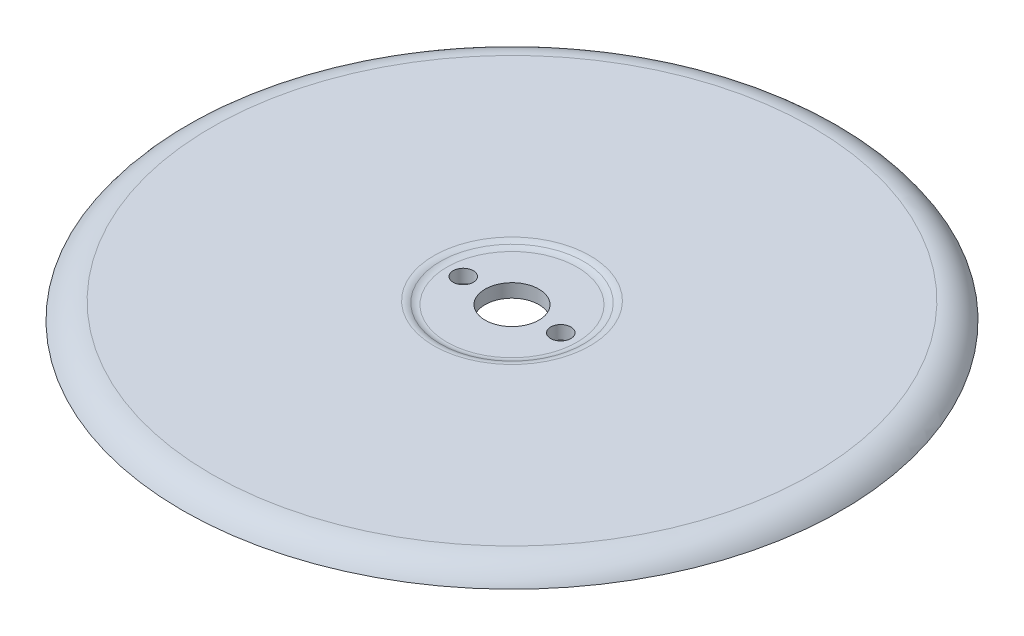
from build123d import *

# Parameters (mm, degrees)
CROQUIS1_R              = 49
CROQUIS1_R_2            = 4
CROQUIS1_R_3            = 1.5
SALIENTE_EXTRUIR1_DEPTH = 2.5
CROQUIS2_R              = 11
CORTAR_EXTRUIR1_DEPTH   = 0.5
REDONDEO1_R             = 2
REDONDEO2_R             = 2
REDONDEO3_R             = 5


with BuildPart() as part:
    # Croquis1 → Saliente-Extruir1 (new body)
    with BuildSketch(Plane(origin=(0, 0, 0), x_dir=(1, 0, 0), z_dir=(0, 1, 0))):
        with Locations(Location((0, 0, 0), (0, 0, 270))):
            Circle(CROQUIS1_R)
        with Locations(Location((0, 0, 0), (0, 0, 270))):
            Circle(CROQUIS1_R_2, mode=Mode.SUBTRACT)
        with Locations(Location((7.25, 0, 0), (0, 0, 270))):
            Circle(CROQUIS1_R_3, mode=Mode.SUBTRACT)
        with Locations(Location((-7.25, 0, 0), (0, 0, 90))):
            Circle(CROQUIS1_R_3, mode=Mode.SUBTRACT)
    extrude(amount=SALIENTE_EXTRUIR1_DEPTH)

    # Croquis2 → Cortar-Extruir1 (cut)
    with BuildSketch(Plane(origin=(0, 2.5, 0), x_dir=(1, 0, 0), z_dir=(0, 1, 0))):
        with Locations(Location((0, 0, 0), (0, 0, 270))):
            Circle(CROQUIS2_R)
    extrude(amount=-CORTAR_EXTRUIR1_DEPTH, mode=Mode.SUBTRACT)

    # Redondeo1
    # the kernel refuses this fillet: 2 mm, written as the material it adds along each edge
    with BuildSketch(Plane(origin=(0, 2, 0), x_dir=(0, 0, 1), z_dir=(-1, 0, 0))) as redondeo1_piece_1:
        with BuildLine():
            CenterArc((9.677124344, 2), REDONDEO1_R, 270, 41.409622109)
            Line((9.677124344, 0), (9.677124344, -0.04))
            Line((9.677124344, -0.04), (11, -0.04))
            Line((11, -0.04), (11.04, 0))
            ThreePointArc((11.04, 0), (11.04, 0.25), (11.026457513, 0.47))
            Line((11.026457513, 0.47), (11, 0.5))
        make_face()
    revolve(axis=Axis((0, 2, 0), (0, 1, 0)))

    # Redondeo2
    redondeo2_edges = [part.edges().sort_by_distance(p)[0] for p in [
        (0, 2.5, -11),
    ]]
    fillet(redondeo2_edges, radius=REDONDEO2_R)

    # Redondeo3
    # the kernel refuses this fillet: 5 mm, written as the material it takes off along each edge
    with BuildSketch(Plane(origin=(0, 2.5, 0), x_dir=(0, 0, 1), z_dir=(-1, 0, 0))) as redondeo3_piece_1:
        with BuildLine():
            CenterArc((44.669872981, -5), REDONDEO3_R, 30, 60)
            Line((49, -2.5), (49.08660254, -2.45))
            ThreePointArc((49.08660254, -2.45), (49.1, -1.25), (49.1, 0))
            Line((49.1, 0), (49, 0.1))
            Line((49, 0.1), (44.669872981, 0.1))
            Line((44.669872981, 0.1), (44.669872981, 0))
        make_face()
    revolve(axis=Axis((0, 2.5, 0), (0, 1, 0)), mode=Mode.SUBTRACT)


solid = part.part
